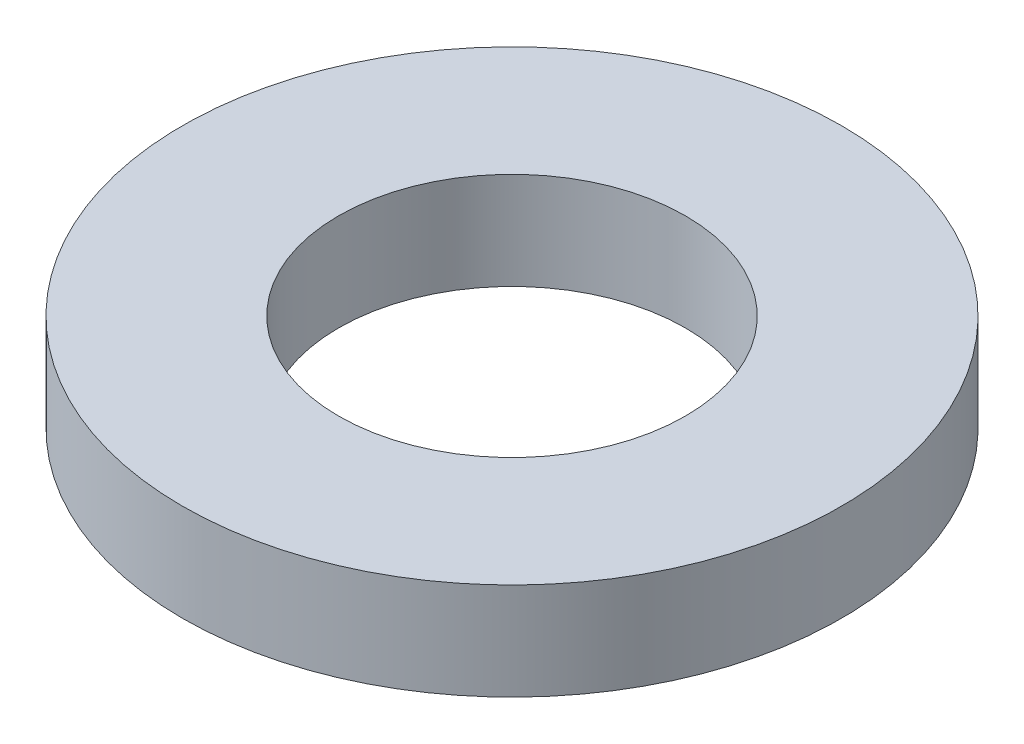
from build123d import *

# Parameters (mm, degrees)
SKETCH1_R           = 95
BOSS_EXTRUDE1_DEPTH = 28
SKETCH2_R           = 50
CUT_EXTRUDE1_DEPTH  = 138.237021244


with BuildPart() as part:
    # Sketch1 → Boss-Extrude1 (new body)
    with BuildSketch(Plane(origin=(0, 0, 0), x_dir=(1, 0, 0), z_dir=(0, 1, 0))):
        Circle(SKETCH1_R)
    extrude(amount=BOSS_EXTRUDE1_DEPTH)

    # Sketch2 → Cut-Extrude1 (cut, through all)
    with BuildSketch(Plane(origin=(0, 0, 0), x_dir=(1, 0, 0), z_dir=(0, 1, 0))):
        Circle(SKETCH2_R)
    extrude(amount=CUT_EXTRUDE1_DEPTH, mode=Mode.SUBTRACT)


solid = part.part
